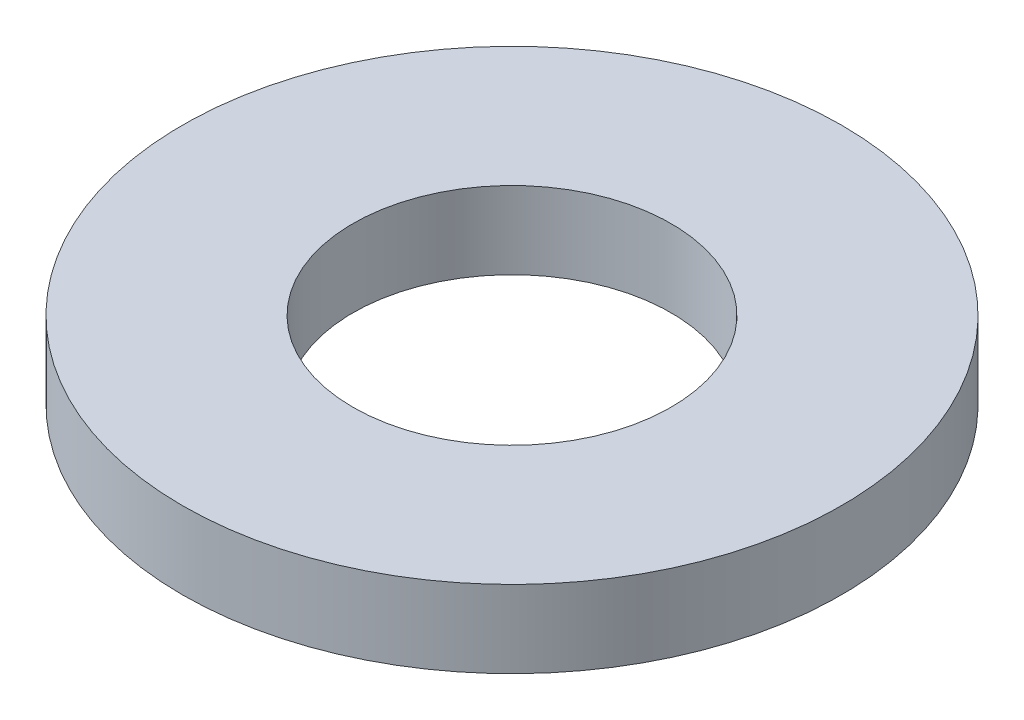
from build123d import *

# Parameters (mm, degrees)
SKETCH1_R           = 72.5
BOSS_EXTRUDE1_DEPTH = 17
SKETCH2_R           = 35
CUT_EXTRUDE1_DEPTH  = 104.930265082


with BuildPart() as part:
    # Sketch1 → Boss-Extrude1 (new body)
    with BuildSketch(Plane(origin=(0, 0, 0), x_dir=(1, 0, 0), z_dir=(0, 1, 0))):
        Circle(SKETCH1_R)
    extrude(amount=BOSS_EXTRUDE1_DEPTH)

    # Sketch2 → Cut-Extrude1 (cut, through all)
    with BuildSketch(Plane(origin=(0, 0, 0), x_dir=(1, 0, 0), z_dir=(0, 1, 0))):
        Circle(SKETCH2_R)
    extrude(amount=CUT_EXTRUDE1_DEPTH, mode=Mode.SUBTRACT)


solid = part.part
